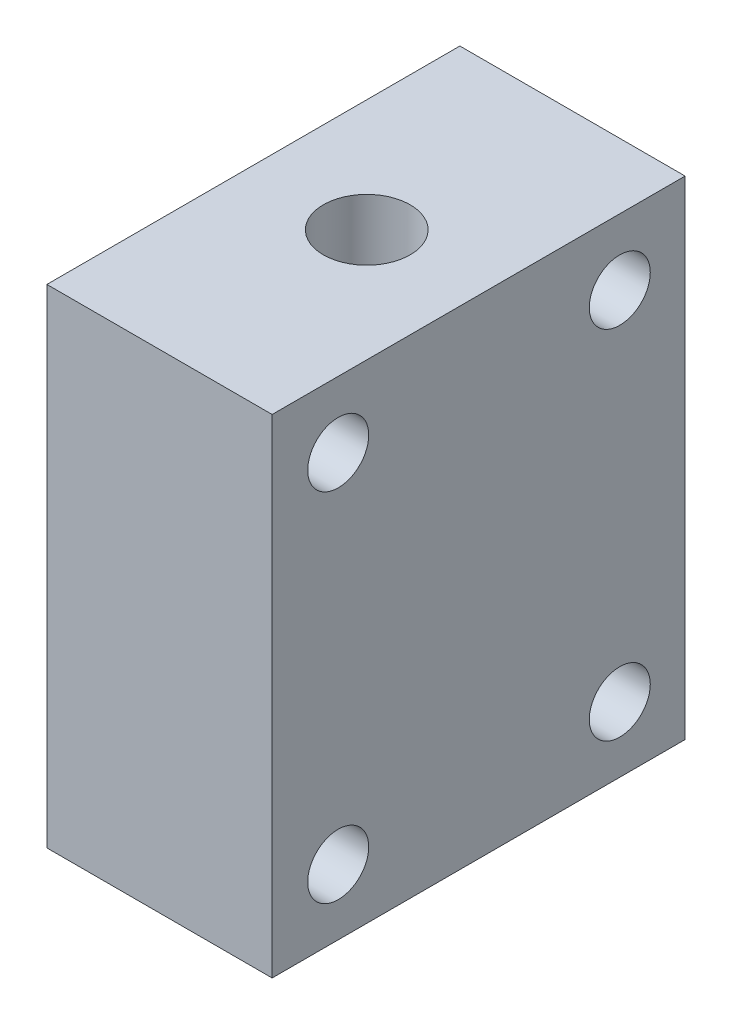
from build123d import *

# Parameters (mm, degrees)
SKETCH1_W           = 82.55
SKETCH1_H           = 69.85
BOSS_EXTRUDE1_DEPTH = 38.1
SKETCH2_R           = 5.159375
CUT_EXTRUDE2_DEPTH  = 115.652235041
SKETCH3_R           = 5.159375
CUT_EXTRUDE4_DEPTH  = 115.652235041
SKETCH4_R           = 7.3421875
CUT_EXTRUDE6_DEPTH  = 28.448
SKETCH5_R           = 12.7254
CUT_EXTRUDE8_DEPTH  = 2.8194
SKETCH6_R           = 7.3421875
CUT_EXTRUDE10_DEPTH = 28.448
SKETCH7_R           = 12.7254
CUT_EXTRUDE12_DEPTH = 2.8194
CUT_EXTRUDE14_START = 82.55
SKETCH8_R           = 7.3421875
CUT_EXTRUDE14_DEPTH = 60.452


with BuildPart() as part:
    # Sketch1 → Boss-Extrude1 (new body)
    with BuildSketch(Plane.YZ):
        with Locations((41.275, 34.925)):
            Rectangle(SKETCH1_W, SKETCH1_H)
    extrude(amount=BOSS_EXTRUDE1_DEPTH)

    # Sketch2 → Cut-Extrude2 (cut, through all)
    with BuildSketch(Plane.YZ):
        with Locations((11.049, 11.049)):
            Circle(SKETCH2_R)
    extrude(amount=CUT_EXTRUDE2_DEPTH, mode=Mode.SUBTRACT)

    # Sketch3 → Cut-Extrude4 (cut, through all)
    with BuildSketch(Plane.YZ):
        with Locations((71.374, 11.049)):
            Circle(SKETCH3_R)
        with Locations((11.049, 58.674)):
            Circle(SKETCH3_R)
        with Locations((71.374, 58.674)):
            Circle(SKETCH3_R)
    extrude(amount=CUT_EXTRUDE4_DEPTH, mode=Mode.SUBTRACT)

    # Sketch4 → Cut-Extrude6 (cut)
    with BuildSketch(Plane.YZ):
        with Locations((23.622, 34.798)):
            Circle(SKETCH4_R)
    extrude(amount=CUT_EXTRUDE6_DEPTH, mode=Mode.SUBTRACT)

    # Sketch5 → Cut-Extrude8 (cut)
    with BuildSketch(Plane.YZ):
        with Locations((23.622, 34.798)):
            Circle(SKETCH5_R)
    extrude(amount=CUT_EXTRUDE8_DEPTH, mode=Mode.SUBTRACT)

    # Sketch6 → Cut-Extrude10 (cut)
    with BuildSketch(Plane.YZ):
        with Locations((58.674, 34.798)):
            Circle(SKETCH6_R)
    extrude(amount=CUT_EXTRUDE10_DEPTH, mode=Mode.SUBTRACT)

    # Sketch7 → Cut-Extrude12 (cut)
    with BuildSketch(Plane.YZ):
        with Locations((58.674, 34.798)):
            Circle(SKETCH7_R)
    extrude(amount=CUT_EXTRUDE12_DEPTH, mode=Mode.SUBTRACT)

    # Sketch8 → Cut-Extrude14 (cut)
    with BuildSketch(Plane(origin=(0, 0, 0), x_dir=(-1, 0, 0), z_dir=(0, 1, 0)).offset(CUT_EXTRUDE14_START)):
        with Locations((-19.05, 34.798)):
            Circle(SKETCH8_R)
    extrude(amount=-CUT_EXTRUDE14_DEPTH, mode=Mode.SUBTRACT)


solid = part.part
